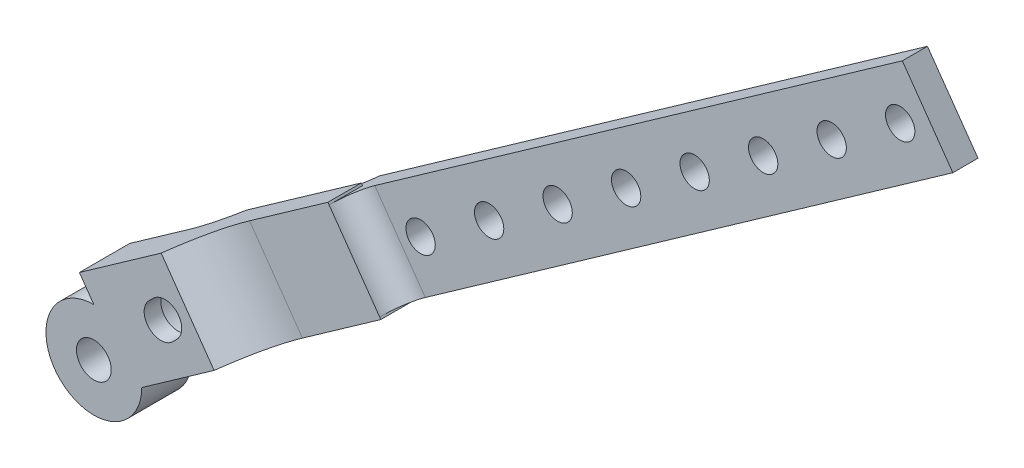
from build123d import *

# Parameters (mm, degrees)
SKETCH_1_R                     = 2.1
EXTRUDE_1_DEPTH                = 2
EXTRUDE_2_DEPTH                = 40
EXTRUDE_3_DEPTH                = 2
SKETCH_10_R                    = 2.075
EXTRUDE_4_DEPTH                = 2
SKETCH_14_R                    = 3.5715559825460215
CUT_EXTRUDE_6_DEPTH            = 4
SKETCH_15_R                    = 2.075
EXTRUDE_6_DEPTH                = 2
SKETCH_16_R                    = 3.75
CUT_EXTRUDE_7_DEPTH            = 2
FILLET_6_R                     = 10
EXTRUDE_7_DEPTH                = 2
FILLET_7_R                     = 10
CUT_EXTRUDE_8_DEPTH            = 39.00000000000002
CUT_EXTRUDE_9_DEPTH            = 1
CUT_EXTRUDE_9_DEPTH_BACK       = 1
EXTRUDE_8_DEPTH                = 20
EXTRUDE_9_DEPTH                = 43
SKETCH_23_R                    = 1.7500000000000038
CUT_EXTRUDE_10_DEPTH           = 32
EXTRUDE_11_DEPTH               = 2.0000000000000036
M3X0_5_1_D                     = 2.8
CUT_EXTRUDE_11_DEPTH           = 61.00000000000001
CUT_EXTRUDE_11_DEPTH_BACK      = 9.000000000000002
CUT_EXTRUDE_12_DEPTH           = 9.000000000000002
SKETCH_32_W                    = 32.392419007521774
SKETCH_32_H                    = 8.622442469611897
CUT_EXTRUDE_13_DEPTH           = 43.000000000000014
FILLET_8_R                     = 5
FILLET_10_R                    = 3
FILLET_11_R                    = 3
CUT_EXTRUDE_14_DEPTH           = 36.00000000000001
SKETCH_34_W                    = 4
SKETCH_34_H                    = 10.963872604458993
EXTRUDE_12_DEPTH               = 70.00000000000003
SKETCH_35_W                    = 2
SKETCH_35_H                    = 10.963872604458997
CUT_EXTRUDE_15_DEPTH           = 80.00000000000004
CUT_EXTRUDE_16_DEPTH           = 80.00000000000004
SKETCH_39_W                    = 2
SKETCH_39_H                    = 10.463872604458926
EXTRUDE_13_DEPTH               = 80.00000000000001
CUT_EXTRUDE_17_DEPTH           = 80.00000000000001
CUT_EXTRUDE_17_DEPTH_BACK      = 80.00000000000004
SKETCH_38_R                    = 1.7500000000000386
SKETCH_38_R_2                  = 1.750000000000034
SKETCH_38_R_3                  = 1.7500000000000169
SKETCH_38_R_4                  = 1.7499999999999991
SKETCH_38_R_5                  = 1.7500000000000349
SKETCH_38_R_6                  = 1.7500000000000082
SKETCH_38_R_7                  = 1.7500000000000238
SKETCH_40_W                    = 2.000000000000001
SKETCH_40_H                    = 10.463872604458992
CUT_EXTRUDE_18_DEPTH           = 80.00000000000001
EXTRUDE_14_DEPTH               = 85.00000000000003
CUT_EXTRUDE_START              = -85.00000000000003
SKETCH_42_R                    = 1.75000000000004
SKETCH_42_R_2                  = 1.7500000000000324
SKETCH_42_R_3                  = 1.7500000000000389
SKETCH_42_R_4                  = 1.750000000000019
SKETCH_42_R_5                  = 1.749999999999997
SKETCH_42_R_6                  = 1.7500000000000255
SKETCH_42_R_7                  = 1.750000000000041
CUT_EXTRUDE_19_DEPTH           = 85.00000000000003
SPLIT_BODIES_1_SURFACE_1_BACK  = 128.924
SPLIT_BODIES_1_SURFACE_1_DEPTH = 257.848
SPLIT_BODIES_1_SURFACE_2_BACK  = 128.924
SPLIT_BODIES_1_SURFACE_2_DEPTH = 257.848
FILLET_15_R                    = 4
FILLET_16_R                    = 3


# Read off the part's stored shape, not the designer's step: 实体-删除/保留 1
# Some blends are built 0.0001 mm under size
with BuildPart() as part:
    # 草图1 → 凸台-拉伸1 (new body)
    with BuildSketch(Plane.XY):
        with BuildLine():
            Line((5.715095935783956, 0), (15.341111112939824, 6.784600591097247))
            Line((15.341111112939824, 6.784600591097247), (38.41017826776328, 23.044122706345174))
            Line((38.41017826776328, 23.044122706345174), (47.05172428264273, 10.78346683185294))
            Line((47.05172428264273, 10.78346683185294), (83.8336919061195, 36.708104876491305))
            Line((83.8336919061195, 36.708104876491305), (40.07067186746126, 98.79923160296066))
            Line((40.07067186746126, 98.79923160296066), (3.288704243984547, 72.87459355832229))
            Line((3.288704243984547, 72.87459355832229), (32.093857626916076, 32.00574064334817))
            Line((32.093857626916076, 32.00574064334817), (-1.7283092029758853, 8.167227110682408))
            Line((-1.7283092029758853, 8.167227110682408), (0, 5.715095935783956))
            ThreePointArc((0, 5.715095935783956), (-4.0411830913245135, -4.041183091324513), (5.715095935783956, 0))
        make_face()
        Circle(SKETCH_1_R, mode=Mode.SUBTRACT)
        with BuildLine():
            Line((7.071067811864017, 9.899494936610912), (6.585786437625429, 9.414213562372302))
            ThreePointArc((6.585786437625429, 9.414213562372302), (6.585786437625458, 6.585786437626118), (9.41421356237164, 6.58578643762615))
            Line((9.41421356237164, 6.58578643762615), (9.899494936610207, 7.071067811864724))
            ThreePointArc((9.899494936610207, 7.071067811864724), (9.899494936610207, 9.899494936610912), (7.071067811864017, 9.899494936610912))
        make_face(mode=Mode.SUBTRACT)
    extrude(amount=EXTRUDE_1_DEPTH)

    # 草图2 → 凸台-拉伸2 (add)
    with BuildSketch(Plane.XY.offset(2)):
        Polygon((4.152858845472472, 71.64852797087305), (39.70876088149996, 96.70901141402354), (81.74347171718236, 37.07001586245262), (46.187569681154784, 12.009532419302161), (47.05172428264273, 10.783466831852932), (83.8336919061195, 36.708104876491305), (40.07067186746126, 98.79923160296066), (3.288704243984547, 72.87459355832229), align=None)
    extrude(amount=-EXTRUDE_2_DEPTH)

    # 草图4 → 凸台-拉伸3 (add)
    with BuildSketch(Plane(origin=(0, 0, -38), x_dir=(-1, 0, 0), z_dir=(0, 0, -1))):
        Polygon((-83.8336919061195, 36.708104876491305), (-47.05172428264273, 10.783466831852936), (-3.288704243984547, 72.87459355832229), (-40.07067186746126, 98.79923160296066), align=None)
    extrude(amount=EXTRUDE_3_DEPTH)

    # 草图10 → 凸台-拉伸4 (add)
    with BuildSketch(Plane.XY.offset(2)):
        with BuildLine():
            Line((8.031882820422537, 15.046398123036559), (14.348203461269724, 6.084780186033628))
            Line((14.348203461269724, 6.084780186033628), (5.715095935783956, 0))
            ThreePointArc((5.715095935783956, 0), (-4.0411830913245135, -4.041183091324513), (0, 5.715095935783956))
            Line((0, 5.715095935783956), (-1.7283092029758853, 8.167227110682408))
            Line((-1.7283092029758853, 8.167227110682408), (8.031882820422537, 15.046398123036559))
        make_face()
        Circle(SKETCH_10_R, mode=Mode.SUBTRACT)
        with BuildLine():
            Line((7.071067811864017, 9.899494936610912), (6.58578643762543, 9.4142135623723))
            ThreePointArc((6.58578643762543, 9.4142135623723), (6.585786437625461, 6.585786437626118), (9.414213562371643, 6.58578643762615))
            Line((9.414213562371643, 6.58578643762615), (9.899494936610205, 7.071067811864723))
            ThreePointArc((9.899494936610205, 7.071067811864723), (9.899494936610207, 9.899494936610912), (7.071067811864017, 9.899494936610912))
        make_face(mode=Mode.SUBTRACT)
    extrude(amount=EXTRUDE_4_DEPTH)

    # 草图14 → 切除-拉伸6 (cut)
    with BuildSketch(Plane(origin=(0, 0, 0), x_dir=(-1, 0, 0), z_dir=(0, 0, -1))):
        with Locations((-7.999999999998536, 7.999999999999225)):
            Circle(SKETCH_14_R)
    extrude(amount=-CUT_EXTRUDE_6_DEPTH, mode=Mode.SUBTRACT)

    # 草图15 → 凸台-拉伸6 (add)
    with BuildSketch(Plane.XY.offset(4)):
        with BuildLine():
            Line((8.031882820422537, 15.046398123036559), (-1.7283092029758853, 8.167227110682408))
            Line((-1.7283092029758853, 8.167227110682408), (3.5e-16, 5.715095935783956))
            ThreePointArc((3.5e-16, 5.715095935783956), (-4.0411830913245135, -4.041183091324513), (5.715095935783956, 0))
            Line((5.715095935783956, 0), (14.348203461269724, 6.084780186033628))
            Line((14.348203461269724, 6.084780186033628), (8.031882820422537, 15.046398123036559))
        make_face()
        Circle(SKETCH_15_R, mode=Mode.SUBTRACT)
        with BuildLine():
            Line((7.071067811864017, 9.899494936610912), (6.58578643762543, 9.4142135623723))
            ThreePointArc((6.58578643762543, 9.4142135623723), (6.585786437625461, 6.585786437626118), (9.414213562371643, 6.58578643762615))
            Line((9.414213562371643, 6.58578643762615), (9.899494936610205, 7.071067811864723))
            ThreePointArc((9.899494936610205, 7.071067811864723), (9.899494936610207, 9.899494936610912), (7.071067811864017, 9.899494936610912))
        make_face(mode=Mode.SUBTRACT)
    extrude(amount=EXTRUDE_6_DEPTH)

    # 草图16 → 切除-拉伸7 (cut)
    with BuildSketch(Plane(origin=(0, 0, 0), x_dir=(-1, 0, 0), z_dir=(0, 0, -1))):
        Circle(SKETCH_16_R)
    extrude(amount=-CUT_EXTRUDE_7_DEPTH, mode=Mode.SUBTRACT)

    # 圆角6
    # the kernel refuses this fillet: 10 mm, written as the material it adds along each edge
    with BuildSketch(Plane(origin=(8.031882820422537, 15.046398123036559, 2), x_dir=(0.8173770582994835, 0.5761030676586291, 0), z_dir=(0.5761030676586291, -0.8173770582994835, 0))) as fillet_6_piece_1:
        with BuildLine():
            CenterArc((8, 10.000000000000002), FILLET_6_R, 216.86989764584402, 53.13010235415595)
            Line((0, 4.000000000000001), (-0.16000000000000011, 3.880000000000001))
            ThreePointArc((-0.16000000000000011, 3.880000000000001), (-0.2000000000000005, 2.0000000000000004), (-0.20000000000000007, 0))
            Line((-0.20000000000000007, 0), (-1.02e-15, -0.2))
            Line((-1.02e-15, -0.2), (8, -0.2))
            Line((8, -0.2), (8, 0))
        make_face()
    extrude(amount=10.963872604458924)

    # 草图17 → 凸台-拉伸7 (add)
    with BuildSketch(Plane(origin=(0, 0, 0), x_dir=(-1, 0, 0), z_dir=(0, 0, -1))):
        Polygon((-10.201001162752062, 16.57523443969374), (-16.517321803599266, 7.613616502690797), (-75.19214589124006, 48.96876075098351), (-68.87582525039278, 57.93037868798654), align=None)
    extrude(amount=EXTRUDE_7_DEPTH)

    # 圆角7
    # the kernel refuses this fillet: 10 mm, written as the material it adds along each edge
    with BuildSketch(Plane(origin=(10.201001162752062, 16.57523443969374, 0), x_dir=(-0.8173770582994832, -0.5761030676586293, 0), z_dir=(0.5761030676586294, -0.8173770582994833, 0))) as fillet_7_piece_1_section:
        with BuildLine():
            CenterArc((6.000000000000635, 10), FILLET_7_R, 233.13010235415305, 36.86989764584695)
            Line((2.2818e-13, 2.0000000000003038), (0, 0))
            Line((0, 0), (6.000000000000635, 0))
        make_face()
    fillet_7_piece_1 = extrude(amount=10.963872604458945, mode=Mode.PRIVATE)
    fillet_7_piece_1 = fillet_7_piece_1 - Plane(origin=(7.999999999998536, 7.999999999999225, 0), x_dir=(-1, 0, 0), z_dir=(0, 0, -1)) * Cylinder(3.5715559825460215, 46, mode=Mode.PRIVATE)
    add(fillet_7_piece_1)

    # 草图18 → 切除-拉伸8 (cut)
    with BuildSketch(Plane(origin=(0, 0, -40), x_dir=(-1, 0, 0), z_dir=(0, 0, -1))):
        Polygon((-40.07067186746127, 98.79923160296067), (-3.288704243984547, 72.87459355832229), (-47.05172428264273, 10.783466831852936), (-83.8336919061195, 36.708104876491305), align=None)
    extrude(amount=-CUT_EXTRUDE_8_DEPTH, mode=Mode.SUBTRACT)

    # 草图19 → 切除-拉伸9 (cut, two sides: drawn at the far end of the back side and taken through both)
    with BuildSketch(Plane(origin=(0, 0, -0.99999999999998), x_dir=(-1, 0, 0), z_dir=(0, 0, -1)).offset(-CUT_EXTRUDE_9_DEPTH_BACK)):
        Polygon((-3.288704243984547, 72.87459355832229), (-40.07067186746127, 98.79923160296067), (-83.8336919061195, 36.708104876491305), (-47.05172428264273, 10.783466831852936), (-46.18756968115477, 12.00953241930218), (-81.74347171718236, 37.07001586245262), (-73.96608030379087, 48.1046061494956), (-38.410178267763285, 23.044122706345178), (-32.09385762691605, 32.005740643348155), (-67.6497596629436, 57.06622408649863), (-39.708760881499984, 96.70901141402356), (-4.152858845472495, 71.64852797087306), align=None)
    extrude(amount=CUT_EXTRUDE_9_DEPTH + CUT_EXTRUDE_9_DEPTH_BACK, mode=Mode.SUBTRACT)

    # 草图21 → 凸台-拉伸8 (add)
    with BuildSketch(Plane(origin=(0, 0, 0), x_dir=(-1, 0, 0), z_dir=(0, 0, -1))):
        Polygon((-4.440910379301805, 71.23983944172332), (-3.288704243984547, 72.87459355832229), (-40.07067186746127, 98.79923160296067), (-55.049351626585654, 77.54742808717405), (-18.267384003108916, 51.62279004253576), (-17.115177867791655, 53.25754415913473), (-52.262391374669434, 78.02997606845577), (-39.588123886179574, 96.0122713510444), align=None)
    extrude(amount=EXTRUDE_8_DEPTH)

    # 草图22 → 凸台-拉伸9 (add)
    with BuildSketch(Plane(origin=(71.66058146886564, 50.50775574776218, 0), x_dir=(0, 0, 1), z_dir=(-0.817377058299483, -0.5761030676586297, 0))):
        Polygon((-20, 55.671388303890474), (-18.2, 55.671388303890474), (-18.199999999999996, 33.67138830389047), (-20, 33.67138830389047), align=None)
    extrude(amount=EXTRUDE_9_DEPTH)

    # 草图23 → 切除-拉伸10 (cut)
    with BuildSketch(Plane(origin=(0, 0, 0), x_dir=(-1, 0, 0), z_dir=(0, 0, -1))):
        with Locations((-37.90905212138934, 32.434124806742865)):
            Circle(SKETCH_23_R)
        with Locations((-62.43036387037384, 49.717216836501734)):
            Circle(SKETCH_23_R)
    extrude(amount=-CUT_EXTRUDE_10_DEPTH, mode=Mode.SUBTRACT)

    # 草图24 → 凸台-拉伸11 (add)
    with BuildSketch(Plane.XY.offset(2)):
        Polygon((83.8336919061195, 36.708104876491305), (40.07067186746127, 98.79923160296067), (71.13100008284161, 120.69114817398862), (114.89402012149985, 58.600021447519275), align=None)
    extrude(amount=-EXTRUDE_11_DEPTH)

    # M3x0.5 螺纹孔1 (through all)
    with Locations(Plane(origin=(0, 0, 0), x_dir=(-1, 0, 0), z_dir=(0, 0, -1))):
        with Locations((-52.570138543, 71.518041511), (-70.348679211, 46.293785492), (-95.527166458, 63.980975204), (-77.720830627, 89.244732903)):
            Hole(M3X0_5_1_D / 2)

    # 草图30 → 切除-拉伸11 (cut, two sides: drawn at the far end of the back side and taken through both)
    with BuildSketch(Plane(origin=(0, 0, 0), x_dir=(-1, 0, 0), z_dir=(0, 0, -1)).offset(-CUT_EXTRUDE_11_DEPTH_BACK)):
        Polygon((-110.82692528953335, 59.40373153966725), (-107.41459612000592, 64.24515616507918), (-45.39560218416546, 20.53297670426469), (-48.8079313536929, 15.691552078852727), align=None)
        Polygon((-48.80793135369289, 27.650857852557387), (-46.31007453974703, 31.19482588406629), (-62.60146912044069, 42.67731404430527), (-65.09932593438657, 39.13334601279635), align=None)
        Polygon((-43.46911835731699, 35.22558450611264), (-59.760512938010656, 46.70807266635163), (-56.95362864403973, 50.69048997323613), (-40.556312151489024, 39.13334601279635), align=None)
        Polygon((-31.51288633622315, 39.13334601279635), (-60.918711059524995, 61.052152622417715), (-58.3570707910252, 64.48879705663575), (-29.095229220949626, 42.67731404430526), align=None)
        Polygon((-26.09074219982254, 46.70807266635163), (-52.15495056838951, 64.48879705663575), (-49.675206086470844, 68.12377701914218), (-23.610997717903878, 50.34305262885806), align=None)
        Polygon((-19.725603614804214, 59.2334148240002), (-47.55900294671991, 78.22106238142037), (-44.841022196812105, 82.20526544606386), (-16.35216983908442, 62.77047483952678), align=None)
        Polygon((-13.940076546018872, 66.30628703788899), (-42.42892890374655, 85.74107764442608), (-39.12284638410603, 90.58736071952248), (-10.633994026378353, 71.15257011298539), align=None)
        Polygon((-76.78552232302457, 46.70807266635163), (-92.60127958902243, 57.855322501380925), (-88.09760195566247, 64.24515616507918), (-72.28184468966458, 53.0979063300499), align=None)
        Polygon((-68.92872629393347, 57.855322501380925), (-84.69340095602348, 68.96656833493195), (-80.38944036995649, 75.07304274961243), (-64.62476570786649, 63.96179691606138), align=None)
        Polygon((-58.3570707910252, 72.85442450484904), (-74.53368350634457, 84.25601219928431), (-78.5517126278179, 78.55521835206666), (-62.37509991249855, 67.15363065763138), align=None)
    extrude(amount=CUT_EXTRUDE_11_DEPTH + CUT_EXTRUDE_11_DEPTH_BACK, mode=Mode.SUBTRACT)

    # 草图31 → 切除-拉伸12 (cut)
    with BuildSketch(Plane(origin=(0, 0, 0), x_dir=(-1, 0, 0), z_dir=(0, 0, -1))):
        Polygon((-42.631920866610876, 100.60444914664545), (-53.41782577998694, 85.54871581236304), (-81.80043116076382, 105.5533218408563), (-71.13100008284161, 120.69114817398862), align=None)
    extrude(amount=-CUT_EXTRUDE_12_DEPTH, mode=Mode.SUBTRACT)

    # 草图32 → 切除-拉伸13 (cut)
    with BuildSketch(Plane(origin=(-18.24598395887897, 25.887466204094725, 0), x_dir=(0.8173770582994834, 0.5761030676586292, 0), z_dir=(0.5761030676586292, -0.8173770582994835, 0))):
        with Locations((67.66927289758625, -9.999246119121606)):
            Rectangle(SKETCH_32_W, SKETCH_32_H)
    extrude(amount=-CUT_EXTRUDE_13_DEPTH, mode=Mode.SUBTRACT)

    # 圆角8
    # the kernel refuses this fillet: 5 mm, written as the material it adds along each edge
    with BuildSketch(Plane(origin=(53.41782577998694, 85.54871581236304, 0), x_dir=(-0.5823749119511797, 0.8129203293865, 0), z_dir=(0, 0, 1))) as fillet_8_piece_1:
        with BuildLine():
            CenterArc((FILLET_8_R * 0.992335375528, -FILLET_8_R), FILLET_8_R, 90.00000000000001, 89.55916210418825)
            Line((-FILLET_8_R * 0.00763502524001, -FILLET_8_R * 0.992306003164), (-FILLET_8_R * 0.0276344332554, -FILLET_8_R * 0.992152123227))
            Line((-FILLET_8_R * 0.0276344332554, -FILLET_8_R * 0.992152123227), (-FILLET_8_R * 0.0198467075106, FILLET_8_R * 0.02))
            Line((-FILLET_8_R * 0.0198467075106, FILLET_8_R * 0.02), (FILLET_8_R * 0.992335375528, FILLET_8_R * 0.02))
            Line((FILLET_8_R * 0.992335375528, FILLET_8_R * 0.02), (FILLET_8_R * 0.992335375528, -1.5e-16))
        make_face()
    extrude(amount=2)
    # the kernel refuses this fillet: 5 mm, written as the material it takes off along each edge
    with BuildSketch(Plane(origin=(114.89402012149985, 58.600021447519275, 31.999999999999986), x_dir=(-0.5761030676586305, 0.8173770582994824, 0), z_dir=(0, 0, -1))) as fillet_8_2_piece_1:
        with BuildLine():
            CenterArc((FILLET_8_R, -FILLET_8_R), FILLET_8_R, 90.00000000000001, 89.99999999999999)
            Line((2.3e-16, -FILLET_8_R), (-FILLET_8_R * 0.02, -FILLET_8_R))
            Line((-FILLET_8_R * 0.02, -FILLET_8_R), (-FILLET_8_R * 0.02, FILLET_8_R * 0.02))
            Line((-FILLET_8_R * 0.02, FILLET_8_R * 0.02), (FILLET_8_R, FILLET_8_R * 0.02))
            Line((FILLET_8_R, FILLET_8_R * 0.02), (FILLET_8_R, 5.2e-16))
        make_face()
    extrude(amount=61.99999999999997, mode=Mode.SUBTRACT)
    with BuildSketch(Plane(origin=(42.631920866610876, 100.60444914664545, -29.770061265848234), x_dir=(0.5823749119511797, -0.8129203293865, 0), z_dir=(0, 0, 1))) as fillet_8_2_piece_2:
        with BuildLine():
            CenterArc((FILLET_8_R * 0.992335375528, -FILLET_8_R), FILLET_8_R, 89.99999999999983, 89.55916210418849)
            Line((-FILLET_8_R * 0.00763502524001, -FILLET_8_R * 0.992306003164), (-FILLET_8_R * 0.0276344332554, -FILLET_8_R * 0.992152123227))
            Line((-FILLET_8_R * 0.0276344332554, -FILLET_8_R * 0.992152123227), (-FILLET_8_R * 0.0198467075106, FILLET_8_R * 0.02))
            Line((-FILLET_8_R * 0.0198467075106, FILLET_8_R * 0.02), (FILLET_8_R * 0.992335375528, FILLET_8_R * 0.02))
            Line((FILLET_8_R * 0.992335375528, FILLET_8_R * 0.02), (FILLET_8_R * 0.992335375528, -1.5e-16))
        make_face()
    extrude(amount=61.54012253169647, mode=Mode.SUBTRACT)
    with BuildSketch(Plane(origin=(81.80043116076382, 105.5533218408563, -29.999999999999986), x_dir=(-0.8173770582994824, -0.5761030676586305, 0), z_dir=(0, 0, 1))) as fillet_8_2_piece_3:
        with BuildLine():
            CenterArc((FILLET_8_R, FILLET_8_R), FILLET_8_R, 180, 90)
            Line((5.2e-16, FILLET_8_R), (-FILLET_8_R * 0.02, FILLET_8_R))
            Line((-FILLET_8_R * 0.02, FILLET_8_R), (-FILLET_8_R * 0.02, -FILLET_8_R * 0.02))
            Line((-FILLET_8_R * 0.02, -FILLET_8_R * 0.02), (FILLET_8_R, -FILLET_8_R * 0.02))
            Line((FILLET_8_R, -FILLET_8_R * 0.02), (FILLET_8_R, -2.3e-16))
        make_face()
    extrude(amount=61.99999999999997, mode=Mode.SUBTRACT)

    # 圆角10
    # the kernel refuses this fillet: 3 mm, written as the material it adds along each edge
    with BuildSketch(Plane(origin=(23.82691717962884, 55.54125592706461, -5.6880248843156584), x_dir=(0.8173770582994834, 0.576103067658629, 0), z_dir=(-0.5761030676586291, 0.8173770582994834, 0))) as fillet_10_piece_1:
        with BuildLine():
            CenterArc((FILLET_10_R, FILLET_10_R), FILLET_10_R, 180, 90)
            Line((1.079e-14, FILLET_10_R), (0, 0))
            Line((0, 0), (FILLET_10_R, 0))
        make_face()
    extrude(amount=1.9999999999999785)
    with BuildSketch(Plane(origin=(23.82691717962884, 55.54125592706461, -14.310467353927557), x_dir=(-7.9e-16, -5.6e-16, 1), z_dir=(-0.5761030676586291, 0.8173770582994834, 0))) as fillet_10_piece_2:
        with BuildLine():
            CenterArc((FILLET_10_R, FILLET_10_R), FILLET_10_R, 180.00000000000037, 89.99999999999966)
            Line((-2.9e-15, FILLET_10_R), (0, 0))
            Line((0, 0), (FILLET_10_R, 0))
        make_face()
    extrude(amount=1.9999999999999785)
    with BuildSketch(Plane(origin=(50.30373733920126, 74.20262788618159, -14.310467353927557), x_dir=(-0.8173770582994834, -0.5761030676586291, 0), z_dir=(-0.5761030676586291, 0.8173770582994834, 0))) as fillet_10_piece_3:
        with BuildLine():
            CenterArc((FILLET_10_R, FILLET_10_R), FILLET_10_R, 180, 90)
            Line((0, FILLET_10_R), (0, 0))
            Line((0, 0), (FILLET_10_R, 0))
        make_face()
    extrude(amount=1.9999999999999862)
    with BuildSketch(Plane(origin=(50.30373733920126, 74.20262788618159, -5.6880248843156584), x_dir=(-0.8173770582994834, -0.5761030676586291, 0), z_dir=(-0.5761030676586291, 0.8173770582994834, 0))) as fillet_10_piece_4:
        with BuildLine():
            CenterArc((FILLET_10_R, -FILLET_10_R), FILLET_10_R, 90.00000000000003, 89.99999999999997)
            Line((-2.472e-14, -FILLET_10_R), (0, 0))
            Line((0, 0), (FILLET_10_R, 0))
        make_face()
    extrude(amount=1.9999999999999862)
    with BuildSketch(Plane(origin=(10.000443555821768, 75.15830532625218, -5.6880248843156584), x_dir=(0.8173770582994835, 0.5761030676586292, 0), z_dir=(-0.5761030676586291, 0.8173770582994834, 0))) as fillet_10_piece_5:
        with BuildLine():
            CenterArc((FILLET_10_R, FILLET_10_R), FILLET_10_R, 180, 90)
            Line((1.779e-14, FILLET_10_R), (0, 0))
            Line((0, 0), (FILLET_10_R, 0))
        make_face()
    extrude(amount=2.000000000000003)
    with BuildSketch(Plane(origin=(10.000443555821768, 75.15830532625218, -14.310467353927557), x_dir=(4e-16, 2.8e-16, 1), z_dir=(-0.5761030676586291, 0.8173770582994834, 0))) as fillet_10_piece_6:
        with BuildLine():
            CenterArc((FILLET_10_R, FILLET_10_R), FILLET_10_R, 180.0000000000002, 89.99999999999977)
            Line((1.45e-15, FILLET_10_R), (0, 0))
            Line((0, 0), (FILLET_10_R, 0))
        make_face()
    extrude(amount=2.000000000000003)
    with BuildSketch(Plane(origin=(36.47726371539417, 93.81967728536918, -5.6880248843156584), x_dir=(-0.8173770582994834, -0.5761030676586291, 0), z_dir=(-0.5761030676586291, 0.8173770582994834, 0))) as fillet_10_piece_7:
        with BuildLine():
            CenterArc((FILLET_10_R, -FILLET_10_R), FILLET_10_R, 90.00000000000003, 89.99999999999997)
            Line((-2.472e-14, -FILLET_10_R), (0, 0))
            Line((0, 0), (FILLET_10_R, 0))
        make_face()
    extrude(amount=2.0000000000000417)
    with BuildSketch(Plane(origin=(36.47726371539417, 93.81967728536918, -14.310467353927557), x_dir=(0, 0, 1), z_dir=(-0.5761030676586291, 0.8173770582994834, 0))) as fillet_10_piece_8:
        with BuildLine():
            CenterArc((FILLET_10_R, -FILLET_10_R), FILLET_10_R, 90, 89.99999999999997)
            Line((0, -FILLET_10_R), (0, 0))
            Line((0, 0), (FILLET_10_R, 0))
        make_face()
    extrude(amount=2.0000000000000417)
    with BuildSketch(Plane(origin=(13.940076546018872, 66.30628703788899, -18.199999999999996), x_dir=(0.8260846178646836, 0.5635460976063625, 0), z_dir=(0, 0, -1))) as fillet_10_piece_9:
        with BuildLine():
            CenterArc((FILLET_10_R, -FILLET_10_R), FILLET_10_R, 89.99999999999974, 90.00000000000023)
            Line((-1.189e-14, -FILLET_10_R), (0, 0))
            Line((0, 0), (FILLET_10_R, -2e-16))
        make_face()
    extrude(amount=1.8000000000000043)
    with BuildSketch(Plane(origin=(19.725603614804214, 59.2334148240002, -18.199999999999996), x_dir=(0.8260846178646816, 0.5635460976063652, 0), z_dir=(0, 0, -1))) as fillet_10_piece_10:
        with BuildLine():
            CenterArc((FILLET_10_R * 0.84892895733, -FILLET_10_R), FILLET_10_R, 90.00000000000006, 80.65778296614056)
            Line((-FILLET_10_R * 0.137807417263, -FILLET_10_R * 0.837669081643), (0, 0))
            Line((0, 0), (FILLET_10_R * 0.84892895733, 2.1e-16))
        make_face()
    extrude(amount=1.8000000000000043)
    with BuildSketch(Plane(origin=(16.35216983908442, 62.77047483952678, -18.199999999999996), x_dir=(0.6901705079270946, -0.7236467853778225, 0), z_dir=(0, 0, -1))) as fillet_10_piece_11:
        with BuildLine():
            CenterArc((FILLET_10_R * 1.17795487051, -FILLET_10_R), FILLET_10_R, 90, 99.34221703385924)
            Line((FILLET_10_R * 0.191218495913, -FILLET_10_R * 1.16233091836), (0, 0))
            Line((0, 0), (FILLET_10_R * 1.17795487051, 8e-17))
        make_face()
    extrude(amount=1.8000000000000043)
    with BuildSketch(Plane(origin=(10.633994026378353, 71.15257011298539, -18.199999999999996), x_dir=(0.8260846178646828, 0.5635460976063636, 0), z_dir=(0, 0, -1))) as fillet_10_piece_12:
        with BuildLine():
            CenterArc((FILLET_10_R, FILLET_10_R), FILLET_10_R, 180.00000000000006, 89.99999999999977)
            Line((3.59e-15, FILLET_10_R), (0, 0))
            Line((0, 0), (FILLET_10_R, 1e-17))
        make_face()
    extrude(amount=1.8000000000000043)
    with BuildSketch(Plane(origin=(39.12284638410603, 90.58736071952248, -20), x_dir=(0.5635460976063636, -0.8260846178646828, 0), z_dir=(0, 0, 1)), Plane(origin=(44.841022196812105, 82.20526544606386, -20), x_dir=(0.5635460976063636, -0.8260846178646828, 0), z_dir=(0, 0, 1))) as fillet_10_piece_13:
        with BuildLine():
            CenterArc((FILLET_10_R, -FILLET_10_R), FILLET_10_R, 89.99999999999996, 89.99999999999993)
            Line((1.99e-15, -FILLET_10_R), (0, 0))
            Line((0, 0), (FILLET_10_R, -2e-16))
        make_face()
    extrude(amount=1.8000000000000043)
    with BuildSketch(Plane(origin=(42.42892890374655, 85.74107764442608, -20), x_dir=(-0.5635460976063642, 0.8260846178646823, 0), z_dir=(0, 0, 1))) as fillet_10_piece_14:
        with BuildLine():
            CenterArc((FILLET_10_R, FILLET_10_R), FILLET_10_R, 180.0000000000001, 89.99999999999977)
            Line((9e-17, FILLET_10_R), (0, 0))
            Line((0, 0), (FILLET_10_R, -1e-17))
        make_face()
    extrude(amount=1.8000000000000043)
    with BuildSketch(Plane(origin=(47.55900294671991, 78.22106238142037, -20), x_dir=(-0.8260846178646809, -0.5635460976063664, 0), z_dir=(0, 0, 1))) as fillet_10_piece_15:
        with BuildLine():
            CenterArc((FILLET_10_R, -FILLET_10_R), FILLET_10_R, 89.99999999999996, 89.99999999999982)
            Line((-1.972e-14, -FILLET_10_R), (0, 0))
            Line((0, 0), (FILLET_10_R, -9e-17))
        make_face()
    extrude(amount=1.8000000000000043)
    with BuildSketch(Plane(origin=(19.725603614804214, 59.2334148240002, 2), x_dir=(0.8260846178646816, 0.5635460976063652, 0), z_dir=(0, 0, -1))) as fillet_10_piece_16:
        with BuildLine():
            CenterArc((FILLET_10_R * 0.84892895733, -FILLET_10_R), FILLET_10_R, 90.00000000000006, 80.65778296614056)
            Line((-FILLET_10_R * 0.137807417263, -FILLET_10_R * 0.837669081643), (0, 0))
            Line((0, 0), (FILLET_10_R * 0.84892895733, 2.1e-16))
        make_face()
    extrude(amount=2)
    with BuildSketch(Plane(origin=(13.940076546018872, 66.30628703788899, 2), x_dir=(0.8260846178646836, 0.5635460976063625, 0), z_dir=(0, 0, -1))) as fillet_10_piece_17:
        with BuildLine():
            CenterArc((FILLET_10_R, -FILLET_10_R), FILLET_10_R, 89.99999999999974, 90.00000000000023)
            Line((-1.189e-14, -FILLET_10_R), (0, 0))
            Line((0, 0), (FILLET_10_R, -2e-16))
        make_face()
    extrude(amount=2)
    with BuildSketch(Plane(origin=(16.35216983908442, 62.77047483952678, 2), x_dir=(0.6901705079270946, -0.7236467853778225, 0), z_dir=(0, 0, -1))) as fillet_10_piece_18:
        with BuildLine():
            CenterArc((FILLET_10_R * 1.17795487051, -FILLET_10_R), FILLET_10_R, 90, 99.34221703385924)
            Line((FILLET_10_R * 0.191218495913, -FILLET_10_R * 1.16233091836), (0, 0))
            Line((0, 0), (FILLET_10_R * 1.17795487051, 8e-17))
        make_face()
    extrude(amount=2)
    with BuildSketch(Plane(origin=(10.633994026378353, 71.15257011298539, 2), x_dir=(0.5635460976063638, -0.8260846178646827, 0), z_dir=(0, 0, -1))) as fillet_10_piece_19:
        with BuildLine():
            CenterArc((FILLET_10_R, -FILLET_10_R), FILLET_10_R, 90.00000000000006, 89.99999999999983)
            Line((-4.7e-16, -FILLET_10_R), (0, 0))
            Line((0, 0), (FILLET_10_R, -2.1e-16))
        make_face()
    extrude(amount=2)
    with BuildSketch(Plane(origin=(39.12284638410603, 90.58736071952248, 0), x_dir=(0.5635460976063636, -0.8260846178646828, 0), z_dir=(0, 0, 1)), Plane(origin=(44.841022196812105, 82.20526544606386, 0), x_dir=(0.5635460976063636, -0.8260846178646828, 0), z_dir=(0, 0, 1))) as fillet_10_piece_20:
        with BuildLine():
            CenterArc((FILLET_10_R, -FILLET_10_R), FILLET_10_R, 89.99999999999996, 89.99999999999993)
            Line((1.99e-15, -FILLET_10_R), (0, 0))
            Line((0, 0), (FILLET_10_R, -2e-16))
        make_face()
    extrude(amount=2)
    with BuildSketch(Plane(origin=(42.42892890374655, 85.74107764442608, 0), x_dir=(-0.8260846178646831, -0.5635460976063631, 0), z_dir=(0, 0, 1))) as fillet_10_piece_21:
        with BuildLine():
            CenterArc((FILLET_10_R, -FILLET_10_R), FILLET_10_R, 90.0000000000002, 89.99999999999972)
            Line((4.08e-15, -FILLET_10_R), (0, 0))
            Line((0, 0), (FILLET_10_R, -1.1e-16))
        make_face()
    extrude(amount=2)
    with BuildSketch(Plane(origin=(47.55900294671991, 78.22106238142037, 0), x_dir=(-0.8260846178646809, -0.5635460976063664, 0), z_dir=(0, 0, 1))) as fillet_10_piece_22:
        with BuildLine():
            CenterArc((FILLET_10_R, -FILLET_10_R), FILLET_10_R, 89.99999999999996, 89.99999999999982)
            Line((-1.972e-14, -FILLET_10_R), (0, 0))
            Line((0, 0), (FILLET_10_R, -9e-17))
        make_face()
    extrude(amount=2)
    with BuildSketch(Plane(origin=(52.15495056838951, 64.48879705663575, 0), x_dir=(-0.8260846178646812, -0.5635460976063658, 0), z_dir=(0, 0, 1))) as fillet_10_piece_23:
        with BuildLine():
            CenterArc((FILLET_10_R, -FILLET_10_R), FILLET_10_R, 89.99999999999993, 89.9999999999999)
            Line((-5.86e-15, -FILLET_10_R), (0, 0))
            Line((0, 0), (FILLET_10_R, 1.3e-16))
        make_face()
    extrude(amount=2)
    with BuildSketch(Plane(origin=(78.5517126278179, 78.55521835206666, 2), x_dir=(-0.5761030676586297, 0.8173770582994829, 0), z_dir=(0, 0, -1))) as fillet_10_piece_24:
        with BuildLine():
            CenterArc((FILLET_10_R, -FILLET_10_R), FILLET_10_R, 90, 89.99999999999963)
            Line((3.41e-15, -FILLET_10_R), (0, 0))
            Line((0, 0), (FILLET_10_R, -1e-16))
        make_face()
    extrude(amount=2.0000000000000036)
    with BuildSketch(Plane(origin=(84.69340095602348, 68.96656833493195, -7.11e-15), x_dir=(-0.5761030676586297, 0.8173770582994829, 0), z_dir=(0, 0, 1))) as fillet_10_piece_25:
        with BuildLine():
            CenterArc((FILLET_10_R, FILLET_10_R), FILLET_10_R, 180.00000000000014, 89.99999999999989)
            Line((1.162e-14, FILLET_10_R), (0, 0))
            Line((0, 0), (FILLET_10_R, 1e-16))
        make_face()
    extrude(amount=2.000000000000007)
    with BuildSketch(Plane(origin=(60.918711059524995, 61.052152622417715, 0), x_dir=(-0.8017706748573764, -0.597631813860965, 0), z_dir=(0, 0, 1))) as fillet_10_piece_26:
        with BuildLine():
            CenterArc((FILLET_10_R, -FILLET_10_R), FILLET_10_R, 89.99999999999993, 90.00000000000017)
            Line((-8.33e-15, -FILLET_10_R), (0, 0))
            Line((0, 0), (FILLET_10_R, 1.2e-16))
        make_face()
    extrude(amount=2)
    with BuildSketch(Plane(origin=(65.09932593438657, 39.13334601279635, 0), x_dir=(-0.8173770582994839, -0.5761030676586282, 0), z_dir=(0, 0, 1))) as fillet_10_piece_27:
        with BuildLine():
            CenterArc((FILLET_10_R, -FILLET_10_R), FILLET_10_R, 90, 90.00000000000017)
            Line((1.6e-15, -FILLET_10_R), (0, 0))
            Line((0, 0), (FILLET_10_R, -9e-17))
        make_face()
    extrude(amount=2)
    with BuildSketch(Plane(origin=(59.760512938010656, 46.70807266635163, 2.132e-14), x_dir=(-0.5761030676586293, 0.8173770582994833, 0), z_dir=(0, 0, 1))) as fillet_10_piece_28:
        with BuildLine():
            CenterArc((FILLET_10_R, FILLET_10_R), FILLET_10_R, 180, 90)
            Line((-9e-17, FILLET_10_R), (0, 0))
            Line((0, 0), (FILLET_10_R, -4e-17))
        make_face()
    extrude(amount=1.9999999999999787)
    with BuildSketch(Plane(origin=(92.60127958902243, 57.855322501380925, -7.11e-15), x_dir=(-0.5761030676586308, 0.817377058299482, 0), z_dir=(0, 0, 1))) as fillet_10_piece_29:
        with BuildLine():
            CenterArc((FILLET_10_R, FILLET_10_R), FILLET_10_R, 180.0000000000006, 89.9999999999992)
            Line((5.2e-15, FILLET_10_R), (0, 0))
            Line((0, 0), (FILLET_10_R, -8e-17))
        make_face()
    extrude(amount=2.000000000000007)
    with BuildSketch(Plane(origin=(110.82692528953335, 59.40373153966725, 2), x_dir=(-0.5761030676586297, 0.8173770582994829, 0), z_dir=(0, 0, -1))) as fillet_10_piece_30:
        with BuildLine():
            CenterArc((FILLET_10_R, -FILLET_10_R), FILLET_10_R, 90.00000000000011, 89.99999999999915)
            Line((1.262e-14, -FILLET_10_R), (0, 0))
            Line((0, 0), (FILLET_10_R, -1e-16))
        make_face()
    extrude(amount=2.0000000000000036)
    with BuildSketch(Plane(origin=(107.41459612000592, 64.24515616507918, -7.11e-15), x_dir=(-0.8173770582994839, -0.5761030676586282, 0), z_dir=(0, 0, 1))) as fillet_10_piece_31:
        with BuildLine():
            CenterArc((FILLET_10_R, FILLET_10_R), FILLET_10_R, 180, 90.00000000000017)
            Line((-9.78e-15, FILLET_10_R), (0, 0))
            Line((0, 0), (FILLET_10_R, -9e-17))
        make_face()
    extrude(amount=2.000000000000007)
    with BuildSketch(Plane(origin=(88.09760195566247, 64.24515616507918, -7.11e-15), x_dir=(-0.8173770582994839, -0.5761030676586282, 0), z_dir=(0, 0, 1))) as fillet_10_piece_32:
        with BuildLine():
            CenterArc((FILLET_10_R, FILLET_10_R), FILLET_10_R, 180.00000000000026, 89.99999999999994)
            Line((-2.11e-15, FILLET_10_R), (0, 0))
            Line((0, 0), (FILLET_10_R, -9e-17))
        make_face()
    extrude(amount=2.000000000000007)
    with BuildSketch(Plane(origin=(80.38944036995649, 75.07304274961243, -7.11e-15), x_dir=(-0.8173770582994829, -0.5761030676586297, 0), z_dir=(0, 0, 1))) as fillet_10_piece_33:
        with BuildLine():
            CenterArc((FILLET_10_R, FILLET_10_R), FILLET_10_R, 179.9999999999998, 90.00000000000034)
            Line((-1e-16, FILLET_10_R), (0, 0))
            Line((0, 0), (FILLET_10_R, -1e-17))
        make_face()
    extrude(amount=2.000000000000007)
    with BuildSketch(Plane(origin=(58.3570707910252, 64.48879705663575, 0), x_dir=(0.5976318138609646, -0.8017706748573767, 0), z_dir=(0, 0, 1))) as fillet_10_piece_34:
        with BuildLine():
            CenterArc((FILLET_10_R, -FILLET_10_R), FILLET_10_R, 89.99999999999994, 90)
            Line((-1.845e-14, -FILLET_10_R), (0, 0))
            Line((0, 0), (FILLET_10_R, 1e-16))
        make_face()
    extrude(amount=2)
    with BuildSketch(Plane(origin=(74.53368350634457, 84.25601219928431, 2), x_dir=(-0.8173770582994829, -0.5761030676586297, 0), z_dir=(0, 0, -1))) as fillet_10_piece_35:
        with BuildLine():
            CenterArc((FILLET_10_R, -FILLET_10_R), FILLET_10_R, 90, 90)
            Line((-1e-16, -FILLET_10_R), (0, 0))
            Line((0, 0), (FILLET_10_R, 1e-17))
        make_face()
    extrude(amount=2.0000000000000036)
    with BuildSketch(Plane(origin=(49.675206086470844, 68.12377701914218, 0), x_dir=(-0.8260846178646809, -0.5635460976063663, 0), z_dir=(0, 0, 1))) as fillet_10_piece_36:
        with BuildLine():
            CenterArc((FILLET_10_R, FILLET_10_R), FILLET_10_R, 180.00000000000017, 89.99999999999972)
            Line((7.68e-15, FILLET_10_R), (0, 0))
            Line((0, 0), (FILLET_10_R, -1.2e-16))
        make_face()
    extrude(amount=2)
    with BuildSketch(Plane(origin=(46.31007453974703, 31.19482588406629, 2), x_dir=(0.5761030676586277, -0.8173770582994844, 0), z_dir=(0, 0, -1))) as fillet_10_piece_37:
        with BuildLine():
            CenterArc((FILLET_10_R, -FILLET_10_R), FILLET_10_R, 90.00000000000003, 89.99999999999991)
            Line((-5.78e-15, -FILLET_10_R), (0, 0))
            Line((0, 0), (FILLET_10_R, 1e-17))
        make_face()
    extrude(amount=1.9999999999999805)
    with BuildSketch(Plane(origin=(72.28184468966458, 53.0979063300499, 2), x_dir=(0.8173770582994829, 0.5761030676586297, 0), z_dir=(0, 0, -1))) as fillet_10_piece_38:
        with BuildLine():
            CenterArc((FILLET_10_R, FILLET_10_R), FILLET_10_R, 179.99999999999986, 90.00000000000006)
            Line((1.574e-14, FILLET_10_R), (0, 0))
            Line((0, 0), (FILLET_10_R, 1e-17))
        make_face()
    extrude(amount=1.9999999999999805)
    with BuildSketch(Plane(origin=(40.556312151489024, 39.13334601279635, 2), x_dir=(0.817377058299483, 0.5761030676586297, 0), z_dir=(0, 0, -1))) as fillet_10_piece_39:
        with BuildLine():
            CenterArc((FILLET_10_R * 1.02695103949, FILLET_10_R), FILLET_10_R, 178.47644092458654, 91.52355907541346)
            Line((FILLET_10_R * 0.0273045625469, FILLET_10_R * 1.02658798862), (0, 0))
            Line((0, 0), (FILLET_10_R * 1.02695103949, 3e-17))
        make_face()
    extrude(amount=2)
    with BuildSketch(Plane(origin=(64.62476570786649, 63.96179691606138, 2), x_dir=(0.8173770582994808, 0.5761030676586326, 0), z_dir=(0, 0, -1))) as fillet_10_piece_40:
        with BuildLine():
            CenterArc((FILLET_10_R, FILLET_10_R), FILLET_10_R, 179.99999999999994, 90.00000000000017)
            Line((-2.639e-14, FILLET_10_R), (0, 0))
            Line((0, 0), (FILLET_10_R, 1.4e-16))
        make_face()
    extrude(amount=1.9999999999999805)
    with BuildSketch(Plane(origin=(29.095229220949626, 42.67731404430526, 2), x_dir=(0.5635460976063654, -0.8260846178646816, 0), z_dir=(0, 0, -1))) as fillet_10_piece_41:
        with BuildLine():
            CenterArc((FILLET_10_R * 0.958980834975, -FILLET_10_R), FILLET_10_R, 90.00000000000006, 87.60091410444892)
            Line((-FILLET_10_R * 0.0401426630865, -FILLET_10_R * 0.958140286414), (0, 0))
            Line((0, 0), (FILLET_10_R * 0.958980834975, 2.3e-16))
        make_face()
    extrude(amount=2)
    with BuildSketch(Plane(origin=(23.610997717903878, 50.34305262885806, 2), x_dir=(0.5635460976063658, -0.8260846178646812, 0), z_dir=(0, 0, -1))) as fillet_10_piece_42:
        with BuildLine():
            CenterArc((FILLET_10_R, -FILLET_10_R), FILLET_10_R, 90.00000000000004, 89.99999999999994)
            Line((-6e-15, -FILLET_10_R), (0, 0))
            Line((0, 0), (FILLET_10_R, -1.4e-16))
        make_face()
    extrude(amount=2)
    with BuildSketch(Plane(origin=(58.3570707910252, 72.85442450484904, 2.842e-14), x_dir=(0.8173770582994845, 0.5761030676586275, 0), z_dir=(0, 0, 1))) as fillet_10_piece_43:
        with BuildLine():
            CenterArc((FILLET_10_R, -FILLET_10_R), FILLET_10_R, 90.00000000000006, 89.99999999999989)
            Line((2.217e-14, -FILLET_10_R), (0, 0))
            Line((0, 0), (FILLET_10_R, 1e-17))
        make_face()
    extrude(amount=1.9999999999999716)
    with BuildSketch(Plane(origin=(26.09074219982254, 46.70807266635163, 2), x_dir=(-0.5635460976063658, 0.8260846178646812, 0), z_dir=(0, 0, -1))) as fillet_10_piece_44:
        with BuildLine():
            CenterArc((FILLET_10_R, FILLET_10_R), FILLET_10_R, 179.99999999999994, 90.00000000000011)
            Line((-3.87e-15, FILLET_10_R), (0, 0))
            Line((0, 0), (FILLET_10_R, -1.4e-16))
        make_face()
    extrude(amount=2)
    with BuildSketch(Plane(origin=(31.51288633622315, 39.13334601279635, 2), x_dir=(0.8017706748573766, 0.5976318138609645, 0), z_dir=(0, 0, -1))) as fillet_10_piece_45:
        with BuildLine():
            CenterArc((FILLET_10_R * 1.04277370676, -FILLET_10_R), FILLET_10_R, 90.00000000000006, 92.39908589555114)
            Line((FILLET_10_R * 0.0436502087001, -FILLET_10_R * 1.04185971359), (0, 0))
            Line((0, 0), (FILLET_10_R * 1.04277370676, 0))
        make_face()
    extrude(amount=2)
    with BuildSketch(Plane(origin=(76.78552232302457, 46.70807266635163, 2), x_dir=(-0.5761030676586308, 0.817377058299482, 0), z_dir=(0, 0, -1))) as fillet_10_piece_46:
        with BuildLine():
            CenterArc((FILLET_10_R, FILLET_10_R), FILLET_10_R, 179.99999999999972, 90.00000000000023)
            Line((1.6e-15, FILLET_10_R), (0, 0))
            Line((0, 0), (FILLET_10_R, 8e-17))
        make_face()
    extrude(amount=1.9999999999999805)
    with BuildSketch(Plane(origin=(68.92872629393347, 57.855322501380925, 2), x_dir=(-0.5761030676586308, 0.817377058299482, 0), z_dir=(0, 0, -1))) as fillet_10_piece_47:
        with BuildLine():
            CenterArc((FILLET_10_R, FILLET_10_R), FILLET_10_R, 179.99999999999991, 90.00000000000028)
            Line((-4.21e-15, FILLET_10_R), (0, 0))
            Line((0, 0), (FILLET_10_R, 8e-17))
        make_face()
    extrude(amount=1.9999999999999805)
    with BuildSketch(Plane(origin=(62.37509991249855, 67.15363065763138, 2.842e-14), x_dir=(-0.576103067658632, 0.8173770582994813, 0), z_dir=(0, 0, 1))) as fillet_10_piece_48:
        with BuildLine():
            CenterArc((FILLET_10_R, -FILLET_10_R), FILLET_10_R, 89.99999999999993, 90.00000000000006)
            Line((-4.22e-15, -FILLET_10_R), (0, 0))
            Line((0, 0), (FILLET_10_R, -4e-17))
        make_face()
    extrude(amount=1.9999999999999716)
    with BuildSketch(Plane(origin=(43.46911835731699, 35.22558450611264, 2), x_dir=(0.8173770582994833, 0.5761030676586292, 0), z_dir=(0, 0, -1))) as fillet_10_piece_49:
        with BuildLine():
            CenterArc((FILLET_10_R * 0.973756256674, -FILLET_10_R), FILLET_10_R, 90, 88.4764409245866)
            Line((-FILLET_10_R * 0.025890220267, -FILLET_10_R * 0.973412011384), (0, 0))
            Line((0, 0), (FILLET_10_R * 0.973756256674, 1.2e-16))
        make_face()
    extrude(amount=1.9999999999999805)
    with BuildSketch(Plane(origin=(48.80793135369289, 27.650857852557387, 0), x_dir=(-0.5761030676586276, 0.8173770582994844, 0), z_dir=(0, 0, 1))) as fillet_10_piece_50:
        with BuildLine():
            CenterArc((FILLET_10_R, -FILLET_10_R), FILLET_10_R, 89.99999999999999, 89.9999999999999)
            Line((3.1e-15, -FILLET_10_R), (0, 0))
            Line((0, 0), (FILLET_10_R, -1e-16))
        make_face()
    extrude(amount=2)
    with BuildSketch(Plane(origin=(48.8079313536929, 15.691552078852727, 2), x_dir=(-0.5761030676586276, 0.8173770582994844, 0), z_dir=(0, 0, -1))) as fillet_10_piece_51:
        with BuildLine():
            CenterArc((FILLET_10_R, FILLET_10_R), FILLET_10_R, 179.99999999999991, 90.00000000000011)
            Line((4.91e-15, FILLET_10_R), (0, 0))
            Line((0, 0), (FILLET_10_R, 1e-16))
        make_face()
    extrude(amount=2)
    with BuildSketch(Plane(origin=(45.39560218416546, 20.53297670426469, 0), x_dir=(0.8173770582994836, 0.5761030676586288, 0), z_dir=(0, 0, 1))) as fillet_10_piece_52:
        with BuildLine():
            CenterArc((FILLET_10_R, -FILLET_10_R), FILLET_10_R, 90, 89.99999999999997)
            Line((-1.597e-14, -FILLET_10_R), (0, 0))
            Line((0, 0), (FILLET_10_R, -4e-17))
        make_face()
    extrude(amount=2)

    # 圆角11
    # the kernel refuses this fillet: 3 mm, written as the material it adds along each edge
    with BuildSketch(Plane(origin=(56.95362864403973, 50.69048997323613, 0), x_dir=(-0.8173770582994829, -0.5761030676586296, 0), z_dir=(0, 0, 1))) as fillet_11_piece_1:
        with BuildLine():
            CenterArc((2.7799365641310985, 2.999999999999997), FILLET_11_R, 202.08219174695722, 67.91780825304272)
            Line((1.25508e-12, 1.8721911955415715), (-0.05559873128134191, 1.8496350194524))
            ThreePointArc((-0.05559873128134191, 1.8496350194524), (-0.06000000000000227, 0.9360955977707908), (-0.06000000000000117, -3.45e-15))
            Line((-0.06000000000000117, -3.45e-15), (3.45e-15, -0.06000000000000117))
            Line((3.45e-15, -0.06000000000000117), (2.7799365641311007, -0.06000000000000109))
            Line((2.7799365641311007, -0.06000000000000109), (2.779936564131097, 2.2e-16))
        make_face()
    extrude(amount=2)
    with BuildSketch(Plane(origin=(62.60146912044069, 42.67731404430527, 2), x_dir=(0.5761030676559975, -0.8173770583013382, 0), z_dir=(0, 0, -1))) as fillet_11_piece_2:
        with BuildLine():
            CenterArc((3.000000000008033, 2.496072029671577), FILLET_11_R, 179.99999999981551, 56.30721761238942)
            Line((8.03589e-12, 2.4960720296812364), (-0.05999999999196515, 2.496072029681433))
            Line((-0.05999999999196515, 2.496072029681433), (-0.06000000000000118, 1.9667e-13))
            Line((-0.06000000000000118, 1.9667e-13), (-1.9667e-13, -0.06000000000000118))
            ThreePointArc((-1.9667e-13, -0.06000000000000118), (0.6678905686951683, -0.06000000000215001), (1.3024967601383868, -0.04992144059343225))
            Line((1.3024967601383868, -0.04992144059343225), (1.3357811373907347, 3e-17))
        make_face()
    extrude(amount=1.9999999999999805)

    # 草图33 → 切除-拉伸14 (cut)
    with BuildSketch(Plane(origin=(0, 0, -20), x_dir=(-1, 0, 0), z_dir=(0, 0, -1))):
        Polygon((-47.05172428264273, 10.783466831852936), (-3.288704243984547, 72.87459355832229), (-71.68485027554038, 121.08151243953441), (-115.44787031419862, 58.990385713065095), align=None)
    extrude(amount=-CUT_EXTRUDE_14_DEPTH, mode=Mode.SUBTRACT)

    # 草图34 → 凸台-拉伸12 (add)
    with BuildSketch(Plane(origin=(36.513367961987875, 25.735323838441115, 0), x_dir=(0, 0, -1), z_dir=(0.8173770582994829, 0.57610306765863, 0))):
        with Locations((0, 2.189452001660963)):
            Rectangle(SKETCH_34_W, SKETCH_34_H)
    extrude(amount=EXTRUDE_12_DEPTH)

    # 草图35 → 切除-拉伸15 (cut)
    with BuildSketch(Plane(origin=(93.72976204295172, 66.06253857454521, 0), x_dir=(0, 0, -1), z_dir=(0.8173770582994827, 0.57610306765863, 0))):
        with Locations((-1, 2.1894520016609853)):
            Rectangle(SKETCH_35_W, SKETCH_35_H)
    extrude(amount=-CUT_EXTRUDE_15_DEPTH, mode=Mode.SUBTRACT)

    # 草图37 → 切除-拉伸16 (cut)
    with BuildSketch(Plane.XY):
        Polygon((30.09238191785381, 17.487436294333747), (30.23640768476847, 17.283092029758876), (95.62657234872707, 63.37133744244937), (95.48254658181241, 63.57568170702422), align=None)
        Polygon((24.064112810835926, 26.040365702186907), (23.92008704392122, 26.244709966761857), (89.31025170787987, 72.33295537945227), (89.45427747479454, 72.12861111487742), align=None)
    extrude(amount=-CUT_EXTRUDE_16_DEPTH, mode=Mode.SUBTRACT)

    # 草图39 → 凸台-拉伸13 (add)
    with BuildSketch(Plane(origin=(28.339597378993055, 19.97429316185486, 0), x_dir=(0, 0, -1), z_dir=(0.8173770582994823, 0.5761030676586307, 0))):
        with Locations((-1, 2.1894520016608894)):
            Rectangle(SKETCH_39_W, SKETCH_39_H)
    extrude(amount=EXTRUDE_13_DEPTH)

    # 草图38 → 切除-拉伸17 (cut, two sides: drawn at the far end of the back side and taken through both)
    with BuildSketch(Plane.XY.offset(-CUT_EXTRUDE_17_DEPTH_BACK)):
        with Locations((31.98250971414171, 25.22051940421218)):
            Circle(SKETCH_38_R)
        with Locations((40.15628029713654, 30.981550080798474)):
            Circle(SKETCH_38_R_2)
        with Locations((48.33005088013136, 36.742580757384786)):
            Circle(SKETCH_38_R_2)
        with Locations((56.50382146312619, 42.50361143397109)):
            Circle(SKETCH_38_R_3)
        with Locations((64.67759204612103, 48.264642110557375)):
            Circle(SKETCH_38_R_4)
        with Locations((72.85136262911584, 54.02567278714369)):
            Circle(SKETCH_38_R_5)
        with Locations((81.02513321211067, 59.78670346372998)):
            Circle(SKETCH_38_R_6)
        with Locations((89.19890379510551, 65.54773414031628)):
            Circle(SKETCH_38_R_7)
    extrude(amount=CUT_EXTRUDE_17_DEPTH + CUT_EXTRUDE_17_DEPTH_BACK, mode=Mode.SUBTRACT)

    # 草图40 → 切除-拉伸18 (cut)
    with BuildSketch(Plane(origin=(93.72976204295172, 66.06253857454521, 0), x_dir=(0, 0, -1), z_dir=(0.8173770582994827, 0.57610306765863, 0))):
        with Locations((1.0000000000000013, 2.1894520016609804)):
            Rectangle(SKETCH_40_W, SKETCH_40_H)
    extrude(amount=-CUT_EXTRUDE_18_DEPTH, mode=Mode.SUBTRACT)

    # 草图41 → 凸台-拉伸14 (add)
    with BuildSketch(Plane(origin=(93.72976204295172, 66.06253857454521, 0), x_dir=(0, 0, -1), z_dir=(0.8173770582994827, 0.57610306765863, 0))):
        Polygon((8.7e-16, -3.0424843005685127), (1, -3.0424843005685127), (1, 7.421388303890477), (0, 7.421388303890477), align=None)
    extrude(amount=-EXTRUDE_14_DEPTH)

    # 草图42 → 切除-拉伸19 (cut)
    with BuildSketch(Plane.XY.offset(2).offset(CUT_EXTRUDE_START)):
        with Locations(Location((31.98250971414171, 25.22051940421218, 0), (0, 0, 180))):
            Circle(SKETCH_42_R)
        with Locations(Location((40.15628029713654, 30.981550080798474, 0), (0, 0, 180))):
            Circle(SKETCH_42_R_2)
        with Locations(Location((48.33005088013136, 36.742580757384786, 0), (0, 0, 180))):
            Circle(SKETCH_42_R_3)
        with Locations(Location((56.50382146312619, 42.50361143397109, 0), (0, 0, 180))):
            Circle(SKETCH_42_R_4)
        with Locations(Location((64.67759204612103, 48.264642110557375, 0), (0, 0, 180))):
            Circle(SKETCH_42_R_5)
        with Locations(Location((72.85136262911584, 54.02567278714369, 0), (0, 0, 180))):
            Circle(SKETCH_42_R_6)
        with Locations(Location((81.02513321211067, 59.78670346372998, 0), (0, 0, 180))):
            Circle(SKETCH_42_R_5)
        with Locations(Location((89.19890379510551, 65.54773414031628, 0), (0, 0, 180))):
            Circle(SKETCH_42_R_7)
    extrude(amount=CUT_EXTRUDE_19_DEPTH, mode=Mode.SUBTRACT)


with BuildPart() as body_2:
    # Split Bodies 1: the piece behind the surface
    add(part.part)
    # Split Bodies 1 surface: a surface, the sketch's curves swept straight by 257.848 mm
    with BuildLine(Plane(origin=(0, 0, -1), x_dir=(-1, 0, 0), z_dir=(0, 0, -1)).offset(-SPLIT_BODIES_1_SURFACE_1_BACK), mode=Mode.PRIVATE) as split_bodies_1_surface_1_path:
        Line((-23.92008704392122, 26.244709966761857), (-30.23640768476846, 17.28309202975889))
    split_bodies_1_surface_1 = Shell.extrude(split_bodies_1_surface_1_path.wire(), (0 * SPLIT_BODIES_1_SURFACE_1_DEPTH, 0 * SPLIT_BODIES_1_SURFACE_1_DEPTH, -1 * SPLIT_BODIES_1_SURFACE_1_DEPTH))
    split(bisect_by=split_bodies_1_surface_1, keep=Keep.BOTTOM)


with BuildPart() as part_1:
    add(part.part)

    # Split Bodies 1: split by a surface, the side it looks to stays
    # Split Bodies 1 surface: a surface, the sketch's curves swept straight by 257.848 mm
    with BuildLine(Plane(origin=(0, 0, -1), x_dir=(-1, 0, 0), z_dir=(0, 0, -1)).offset(-SPLIT_BODIES_1_SURFACE_2_BACK), mode=Mode.PRIVATE) as split_bodies_1_surface_2_path:
        Line((-23.92008704392122, 26.244709966761857), (-30.23640768476846, 17.28309202975889))
    split_bodies_1_surface_2 = Shell.extrude(split_bodies_1_surface_2_path.wire(), (0 * SPLIT_BODIES_1_SURFACE_2_DEPTH, 0 * SPLIT_BODIES_1_SURFACE_2_DEPTH, -1 * SPLIT_BODIES_1_SURFACE_2_DEPTH))
    split(bisect_by=split_bodies_1_surface_2, keep=Keep.TOP)


with BuildPart() as body_3:
    # Move Body 2: copy of body 2
    add(body_2.part.moved(Location((0, 0, -3))))

    # Combine 3: union part
    add(part_1.part)

    # 圆角15
    # the kernel refuses this fillet: 4 mm, written as the material it adds along each edge
    with BuildSketch(Plane(origin=(30.09238191785381, 17.487436294333747, -2.0000000000000666), x_dir=(-6.11e-14, -4.519e-14, -1), z_dir=(-0.5761030676586301, 0.8173770582994827, -1.741705391194204e-15))) as fillet_15_piece_1:
        with BuildLine():
            CenterArc((4.000000000000187, 3.4641016151376545), FILLET_15_R, 179.99999999999565, 60.00000000000148)
            Line((1.8769e-13, 3.4641016151379582), (0, 0))
            Line((0, 0), (2.0000000000000115, 0))
        make_face()
    extrude(amount=10.463872604458945)

    # 圆角16
    fillet_16_edges = [body_3.edges().sort_by_distance(p)[0] for p in [
        (27.07824736434487, 21.763900998260336, -1),
    ]]
    fillet(fillet_16_edges, radius=FILLET_16_R - 0.0001)  # a hair under: the kernel refuses the full size


solid = body_3.part
